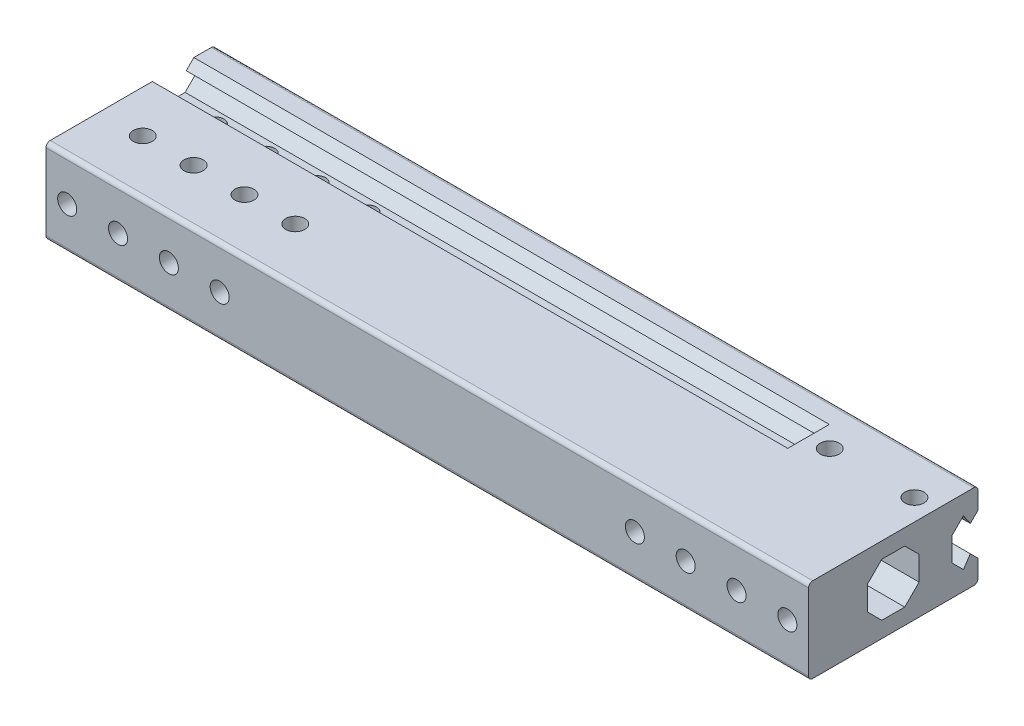
from build123d import *

# Parameters (mm, degrees)
BOSS_EXTRUDE1_DEPTH             = 90
BOSS_EXTRU_2_DEPTH              = 180
BOSS_EXTRUDE2_DEPTH             = 180
DIAM_TRE_DU_PER_AGE_4_5_4_5_1_D = 4.5
DIAM_TRE_DU_PER_AGE_4_0_4_1_D   = 4
F_4_5_4_5_DIAMETER_HOLE1_D      = 4.5
BOSS_EXTRU_1_DEPTH              = 30
BOSS_EXTRU_3_DEPTH              = 30
SYM_TRIE2_START                 = 6.1
SYM_TRIE2_OUTLINE_R             = 2.25
SYM_TRIE2_DEPTH                 = 13.898019485
DIAM_TRE_DU_PER_AGE_4_5_4_5_4_D = 4.5
ESQUISSE15_W                    = 5.4
ESQUISSE15_H                    = 1.96
BOSS_EXTRU_4_DEPTH              = 180


# Read off the part's stored shape, not the designer's step: Symétrie2
with BuildPart() as part:
    # Sketch5 → Boss-Extrude1 (new, symmetric)
    with BuildSketch(Plane(origin=(0, 0, 0), x_dir=(0, 0, -1), z_dir=(1, 0, 0))):
        with BuildLine():
            Line((-19.998019485, 4.9), (-18.198019485, 3.1))
            Line((-18.198019485, 3.1), (-18.198019485, 5.499339828))
            Line((-18.198019485, 5.499339828), (-16.558019485, 5.499339828))
            Line((-16.558019485, 5.499339828), (-13.9, 2.841320344))
            Line((-13.9, 2.841320344), (-13.9, -2.838679656))
            Line((-13.9, -2.838679656), (-16.558019485, -5.496699141))
            Line((-16.558019485, -5.496699141), (-18.198019485, -5.496699141))
            Line((-18.198019485, -5.496699141), (-18.198019485, -3.1))
            Line((-18.198019485, -3.1), (-19.998019485, -4.9))
            Line((-19.998019485, -4.9), (-19.998019485, -9))
            ThreePointArc((-19.998019485, -9), (-19.705126266, -9.707106781), (-18.998019485, -10))
            Line((-18.998019485, -10), (-14.9, -10))
            Line((-14.9, -10), (-13.1, -8.2))
            Line((-13.1, -8.2), (-15.5, -8.2))
            Line((-15.5, -8.2), (-15.5, -6.56))
            Line((-15.5, -6.56), (-12.84, -3.9))
            Line((-12.84, -3.9), (-7.16, -3.9))
            Line((-7.16, -3.9), (-4.5, -6.56))
            Line((-4.5, -6.56), (-4.5, -8.2))
            Line((-4.5, -8.2), (-6.9, -8.2))
            Line((-6.9, -8.2), (-5.1, -10))
            Line((-5.1, -10), (5.1, -10))
            Line((5.1, -10), (6.9, -8.2))
            Line((6.9, -8.2), (4.496038969, -8.2))
            Line((4.496038969, -8.2), (4.496038969, -6.56))
            Line((4.496038969, -6.56), (7.156038969, -3.9))
            Line((7.156038969, -3.9), (12.836038969, -3.9))
            Line((12.836038969, -3.9), (15.496038969, -6.56))
            Line((15.496038969, -6.56), (15.496038969, -8.2))
            Line((15.496038969, -8.2), (13.1, -8.2))
            Line((13.1, -8.2), (14.9, -10))
            Line((14.9, -10), (19.001980515, -10))
            ThreePointArc((19.001980515, -10), (19.709087297, -9.707106781), (20.001980515, -9))
            Line((20.001980515, -9), (20.001980515, -4.9))
            Line((20.001980515, -4.9), (18.201980515, -3.1))
            Line((18.201980515, -3.1), (18.201980515, -5.504621202))
            Line((18.201980515, -5.504621202), (16.561980515, -5.504621202))
            Line((16.561980515, -5.504621202), (13.9, -2.842640687))
            Line((13.9, -2.842640687), (13.9, 2.837359313))
            Line((13.9, 2.837359313), (16.561980515, 5.499339828))
            Line((16.561980515, 5.499339828), (18.201980515, 5.499339828))
            Line((18.201980515, 5.499339828), (18.201980515, 3.1))
            Line((18.201980515, 3.1), (20.001980515, 4.9))
            Line((20.001980515, 4.9), (20.001980515, 9))
            ThreePointArc((20.001980515, 9), (19.709087297, 9.707106781), (19.001980515, 10))
            Line((19.001980515, 10), (14.9, 10))
            Line((14.9, 10), (13.1, 8.2))
            Line((13.1, 8.2), (15.501320344, 8.2))
            Line((15.501320344, 8.2), (15.501320344, 6.56))
            Line((15.501320344, 6.56), (12.841320344, 3.9))
            Line((12.841320344, 3.9), (7.161320344, 3.9))
            Line((7.161320344, 3.9), (4.501320344, 6.56))
            Line((4.501320344, 6.56), (4.501320344, 8.2))
            Line((4.501320344, 8.2), (6.9, 8.2))
            Line((6.9, 8.2), (5.1, 10))
            Line((5.1, 10), (-5.1, 10))
            Line((-5.1, 10), (-6.9, 8.2))
            Line((-6.9, 8.2), (-4.501320344, 8.2))
            Line((-4.501320344, 8.2), (-4.501320344, 6.56))
            Line((-4.501320344, 6.56), (-7.161320344, 3.9))
            Line((-7.161320344, 3.9), (-12.841320344, 3.9))
            Line((-12.841320344, 3.9), (-15.501320344, 6.56))
            Line((-15.501320344, 6.56), (-15.501320344, 8.2))
            Line((-15.501320344, 8.2), (-13.1, 8.2))
            Line((-13.1, 8.2), (-14.9, 10))
            Line((-14.9, 10), (-18.998019485, 10))
            ThreePointArc((-18.998019485, 10), (-19.705126266, 9.707106781), (-19.998019485, 9))
            Line((-19.998019485, 9), (-19.998019485, 4.9))
        make_face()
        Polygon((6.1, -2.84), (6.1, 2.84), (2.7, 6.24), (2.7, 8.2), (-2.7, 8.2), (-2.7, 6.24), (-6.1, 2.84), (-6.1, -2.84), (-2.7, -6.24), (-2.7, -8.2), (2.7, -8.2), (2.7, -6.24), align=None, mode=Mode.SUBTRACT)
    extrude(amount=BOSS_EXTRUDE1_DEPTH, both=True)

    # Esquisse10 → Boss.-Extru.2 (add, through all)
    with BuildSketch(Plane(origin=(90, 0, 0), x_dir=(0, 0, -1), z_dir=(1, 0, 0))):
        Polygon((-19.998019485, 4.9), (-19.998019485, -4.9), (-18.198019485, -3.1), (-18.198019485, -5.496699141), (-16.558019485, -5.496699141), (-13.9, -2.838679656), (-13.9, 2.841320344), (-16.558019485, 5.499339828), (-18.198019485, 5.499339828), (-18.198019485, 3.1), align=None)
    extrude(amount=-BOSS_EXTRU_2_DEPTH)

    # Sketch6 → Boss-Extrude2 (add)
    with BuildSketch(Plane.ZY.offset(90)):
        Polygon((5.1, 10), (14.9, 10), (13.1, 8.2), (15.501320344, 8.2), (15.501320344, 6.56), (12.841320344, 3.9), (7.161320344, 3.9), (4.501320344, 6.56), (4.501320344, 8.2), (6.9, 8.2), align=None)
    boss_extrude2 = extrude(amount=-BOSS_EXTRUDE2_DEPTH)

    # Diamètre du perçage Ø4.5 (4.5)1 (through all)
    with Locations(Plane(origin=(0, 0, -13.9), x_dir=(-1, 0, 0), z_dir=(0, 0, -1))):
        with Locations((85, -0.002640687), (73, -0.002640687), (61, -0.002640687), (49, -0.002640687)):
            Hole(DIAM_TRE_DU_PER_AGE_4_5_4_5_1_D / 2)

    # Diamètre du perçage Ø4.0 (4)1 (through all)
    with Locations(Plane(origin=(0, -3.9, 0), x_dir=(-1, 0, 0), z_dir=(0, -1, 0))):
        with Locations((44, 9.996038969), (80, 9.996038969), (68, 9.996038969), (56, 9.996038969)):
            Hole(DIAM_TRE_DU_PER_AGE_4_0_4_1_D / 2)

    # Mirror1: Boss-Extrude2 across plane
    add(boss_extrude2.mirror(Plane.ZX))

    # Ø4.5 (4.5) Diameter Hole1 (through all)
    with Locations(Plane(origin=(0, 10, 0), x_dir=(-1, 0, 0), z_dir=(0, 1, 0))):
        with Locations((80, 7.160660172), (44, 7.160660172), (56, 7.160660172), (68, 7.160660172)):
            Hole(F_4_5_4_5_DIAMETER_HOLE1_D / 2)

    # Esquisse7 → Boss.-Extru.1 (add)
    with BuildSketch(Plane(origin=(90, 0, 0), x_dir=(0, 0, -1), z_dir=(1, 0, 0))):
        Polygon((14.9, -10), (5.1, -10), (6.9, -8.2), (4.496038969, -8.2), (4.496038969, -6.56), (7.156038969, -3.9), (12.836038969, -3.9), (15.496038969, -6.56), (15.496038969, -8.2), (13.1, -8.2), align=None)
    extrude(amount=-BOSS_EXTRU_1_DEPTH)

    # Esquisse11 → Boss.-Extru.3 (add)
    with BuildSketch(Plane(origin=(90, 0, 0), x_dir=(0, 0, -1), z_dir=(1, 0, 0))):
        Polygon((14.9, 10), (5.1, 10), (6.9, 8.2), (4.501320344, 8.2), (4.501320344, 6.56), (7.161320344, 3.9), (12.841320344, 3.9), (15.501320344, 6.56), (15.501320344, 8.2), (13.1, 8.2), align=None)
    extrude(amount=-BOSS_EXTRU_3_DEPTH)

    # Symétrie2 outline → Symétrie2 (cut)
    with BuildSketch(Plane.XY.offset(SYM_TRIE2_START)):
        with Locations((49, -0.002640687)):
            Circle(SYM_TRIE2_OUTLINE_R)
        with Locations((61, -0.002640687)):
            Circle(SYM_TRIE2_OUTLINE_R)
        with Locations((73, -0.002640687)):
            Circle(SYM_TRIE2_OUTLINE_R)
        with Locations((85, -0.002640687)):
            Circle(SYM_TRIE2_OUTLINE_R)
    extrude(amount=SYM_TRIE2_DEPTH, mode=Mode.SUBTRACT)

    # Diamètre du perçage Ø4.5 (4.5)4 (through all)
    with Locations(Plane(origin=(0, 10, 0), x_dir=(1, 0, 0), z_dir=(0, 1, 0))):
        with Locations((65, 10.001320344), (85, 10.001320344)):
            Hole(DIAM_TRE_DU_PER_AGE_4_5_4_5_4_D / 2)

    # Esquisse15 → Boss.-Extru.4 (add, through all)
    with BuildSketch(Plane.ZY.offset(90)):
        with Locations((0, -7.22)):
            Rectangle(ESQUISSE15_W, ESQUISSE15_H)
        with Locations((0, 7.22)):
            Rectangle(ESQUISSE15_W, ESQUISSE15_H)
        Polygon((-18.201980515, -3.1), (-16.561980515, -5.504621202), (-18.201980515, -5.504621202), align=None)
        Polygon((-18.201980515, 3.1), (-16.561980515, 5.499339828), (-18.201980515, 5.499339828), align=None)
    extrude(amount=-BOSS_EXTRU_4_DEPTH)


solid = part.part
